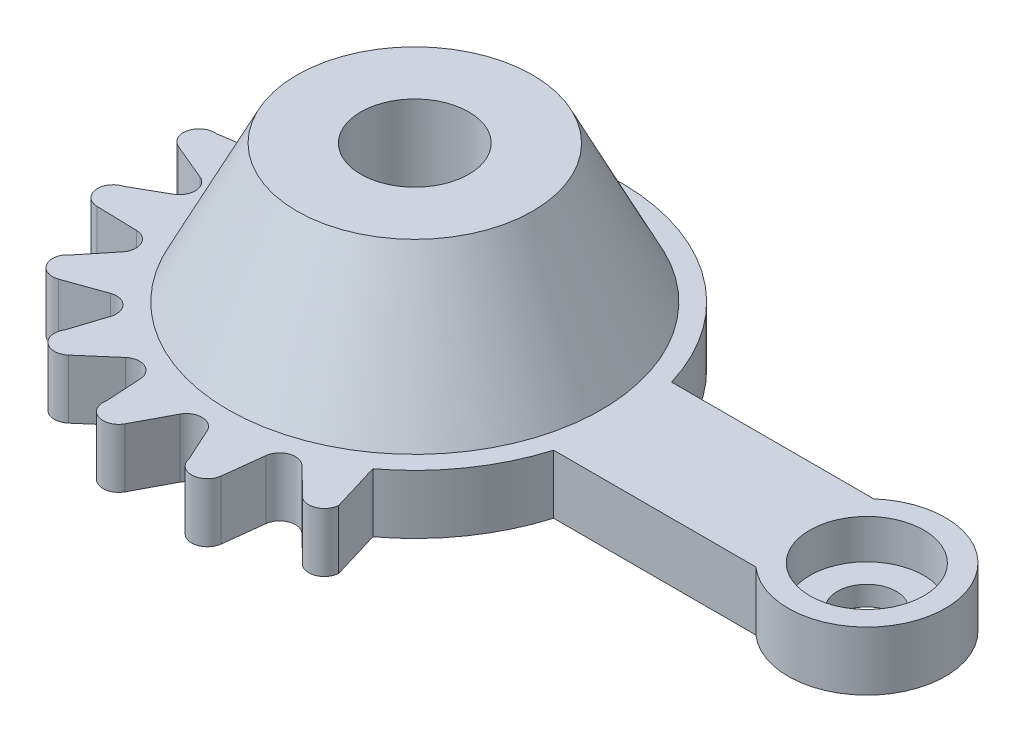
from build123d import *

# Parameters (mm, degrees)
BOSS_EXTRUDE1_DEPTH = 3
BOSS_EXTRUDE2_DEPTH = 3
SKETCH3_R           = 2.9
CUT_EXTRUDE1_DEPTH  = 2
SKETCH4_R           = 1.5
CUT_EXTRUDE2_DEPTH  = 31.164382971
SKETCH8_R           = 1.5
CUT_EXTRUDE4_DEPTH  = 31.901294471


# Read off the part's stored shape, not the designer's step: Boss-Extrude2
with BuildPart() as part:
    # Sketch1 → Boss-Extrude1 (new body)
    with BuildSketch(Plane(origin=(0, 0, 0), x_dir=(1, 0, 0), z_dir=(0, 1, 0))):
        with BuildLine():
            Line((10.062305899, 3), (20.354248689, 3))
            ThreePointArc((20.354248689, 3), (27, 0), (20.354248689, -3))
            Line((20.354248689, -3), (10.062305899, -3))
            ThreePointArc((10.062305899, -3), (-10.5, 0), (10.062305899, 3))
        make_face()
    extrude(amount=BOSS_EXTRUDE1_DEPTH)

    # Boss-Extrude2 outline → Boss-Extrude2 (add)
    with BuildSketch(Plane(origin=(0, 0, 0), x_dir=(1, 0, 0), z_dir=(0, 1, 0))):
        with BuildLine():
            ThreePointArc((-10.969752428, 0.043811644), (-10.62658841, -0.230674076), (-10.480170576, -0.64499976))
            ThreePointArc((-10.480170576, -0.64499976), (-10.419978693, 1.293848534), (-10.00416019, 3.188538678))
            ThreePointArc((-10.00416019, 3.188538678), (-10.247462878, 2.822604668), (-10.647336332, 2.640381949))
            Line((-10.647336332, 2.640381949), (-12.457605143, 2.367968327))
            ThreePointArc((-12.457605143, 2.367968327), (-13.325815839, 1.778572113), (-12.863493028, 0.836534254))
            Line((-12.863493028, 0.836534254), (-12.861422527, 0.835664125))
            Line((-12.861422527, 0.835664125), (-10.969752428, 0.043811644))
        make_face()
        with BuildLine():
            ThreePointArc((-10.243204649, -3.926085368), (-9.824003519, -4.057898639), (-9.53766434, -4.391236606))
            ThreePointArc((-9.53766434, -4.391236606), (-10.18268144, -2.561835023), (-10.480170576, -0.64499976))
            ThreePointArc((-10.480170576, -0.64499976), (-10.574676775, -1.074152903), (-10.881592069, -1.388647488))
            Line((-10.881592069, -1.388647488), (-12.470837309, -2.297262873))
            ThreePointArc((-12.470837309, -2.297262873), (-13.067150653, -3.16073731), (-12.295452057, -3.87183434))
            Line((-12.295452057, -3.87183434), (-12.293207019, -3.871896838))
            Line((-12.293207019, -3.871896838), (-10.243204649, -3.926085368))
        make_face()
        with BuildLine():
            ThreePointArc((-8.130214562, -7.364577311), (-7.691719937, -7.33587578), (-7.304217543, -7.543103214))
            ThreePointArc((-7.304217543, -7.543103214), (-8.567135584, -6.070765016), (-9.53766434, -4.391236606))
            ThreePointArc((-9.53766434, -4.391236606), (-9.470582821, -4.825521696), (-9.64299823, -5.229720158))
            Line((-9.64299823, -5.229720158), (-10.796111745, -6.651554034))
            ThreePointArc((-10.796111745, -6.651554034), (-11.039815297, -7.672233361), (-10.06319217, -8.056140874))
            Line((-10.06319217, -8.056140874), (-10.061076468, -8.055387281))
            Line((-10.061076468, -8.055387281), (-8.130214562, -7.364577311))
        make_face()
        with BuildLine():
            ThreePointArc((-4.916780441, -9.806256059), (-4.518336336, -9.620925825), (-4.08211637, -9.674002581))
            ThreePointArc((-4.08211637, -9.674002581), (-5.792005958, -8.758005879), (-7.304217543, -7.543103214))
            ThreePointArc((-7.304217543, -7.543103214), (-7.084623431, -7.923740715), (-7.099201461, -8.362937666))
            Line((-7.099201461, -8.362937666), (-7.660106573, -10.105541409))
            ThreePointArc((-7.660106573, -10.105541409), (-7.518214471, -11.145274231), (-6.468855097, -11.150029425))
            Line((-6.468855097, -11.150029425), (-6.467155094, -11.148561743))
            Line((-6.467155094, -11.148561743), (-4.916780441, -9.806256059))
        make_face()
        with BuildLine():
            ThreePointArc((-1.037848299, -10.920634538), (-0.733386184, -10.603757733), (-0.307489921, -10.495496651))
            ThreePointArc((-0.307489921, -10.495496651), (-2.232907068, -10.259830702), (-4.08211637, -9.674002581))
            ThreePointArc((-4.08211637, -9.674002581), (-3.739741201, -9.949469528), (-3.594510754, -10.364211511))
            Line((-3.594510754, -10.364211511), (-3.48728761, -12.191719526))
            ThreePointArc((-3.48728761, -12.191719526), (-2.979005292, -13.109775513), (-1.998942976, -12.734734761))
            Line((-1.998942976, -12.734734761), (-1.997888773, -12.732751643))
            Line((-1.997888773, -12.732751643), (-1.037848299, -10.920634538))
        make_face()
        with BuildLine():
            ThreePointArc((2.981559098, -10.556878949), (3.150822189, -10.151350876), (3.508737967, -9.896401259))
            ThreePointArc((3.508737967, -9.896401259), (1.628412136, -10.372958783), (-0.307489921, -10.495496651))
            ThreePointArc((-0.307489921, -10.495496651), (0.111325954, -10.628511574), (0.396705602, -10.962664478))
            Line((0.396705602, -10.962664478), (1.157544092, -12.627719175))
            ThreePointArc((1.157544092, -12.627719175), (1.963419396, -13.299837247), (2.741530869, -12.595763214))
            Line((2.741530869, -12.595763214), (2.741796583, -12.59353308))
            Line((2.741796583, -12.59353308), (2.981559098, -10.556878949))
        make_face()
        with BuildLine():
            Line((7.031129829, -10.903441128), (6.281480785, -8.413857567))
            ThreePointArc((6.281480785, -8.413857567), (4.950917062, -9.25950432), (3.508737967, -9.896401259))
            ThreePointArc((3.508737967, -9.896401259), (3.947316897, -9.868954826), (4.334226904, -10.077294525))
            Line((4.334226904, -10.077294525), (5.804964161, -11.509633365))
            ThreePointArc((5.804964161, -11.509633365), (6.588651042, -11.551623858), (7.031129829, -10.903441128))
        make_face()
    extrude(amount=BOSS_EXTRUDE2_DEPTH)

    # Sketch3 → Cut-Extrude1 (cut)
    with BuildSketch(Plane(origin=(0, 3, 0), x_dir=(1, 0, 0), z_dir=(0, 1, 0))):
        with Locations(Location((23, 0, 0), (0, 0, 270))):
            Circle(SKETCH3_R)
    extrude(amount=-CUT_EXTRUDE1_DEPTH, mode=Mode.SUBTRACT)

    # Sketch4 → Cut-Extrude2 (cut, through all)
    with BuildSketch(Plane(origin=(0, 1, 0), x_dir=(1, 0, 0), z_dir=(0, 1, 0))):
        with Locations(Location((23, 0, 0), (0, 0, 270))):
            Circle(SKETCH4_R)
    extrude(amount=-CUT_EXTRUDE2_DEPTH, mode=Mode.SUBTRACT)

    # Sketch7 → Revolve1 (revolve)
    with BuildSketch(Plane.XY, mode=Mode.PRIVATE) as revolve1_sk:
        Polygon((2.75, 3), (9.5, 3), (6, 10), (2.75, 10), align=None)
    revolve(revolve1_sk.sketch.rotate(Axis((0, 0, 0), (0, 1, 0)), 90), axis=Axis((0, 0, 0), (0, 1, 0)))

    # Sketch8 → Cut-Extrude4 (cut, through all)
    with BuildSketch(Plane(origin=(0, 3, 0), x_dir=(1, 0, 0), z_dir=(0, 1, 0))):
        with Locations(Location((0, 0, 0), (0, 0, 270))):
            Circle(SKETCH8_R)
    extrude(amount=-CUT_EXTRUDE4_DEPTH, mode=Mode.SUBTRACT)


solid = part.part
